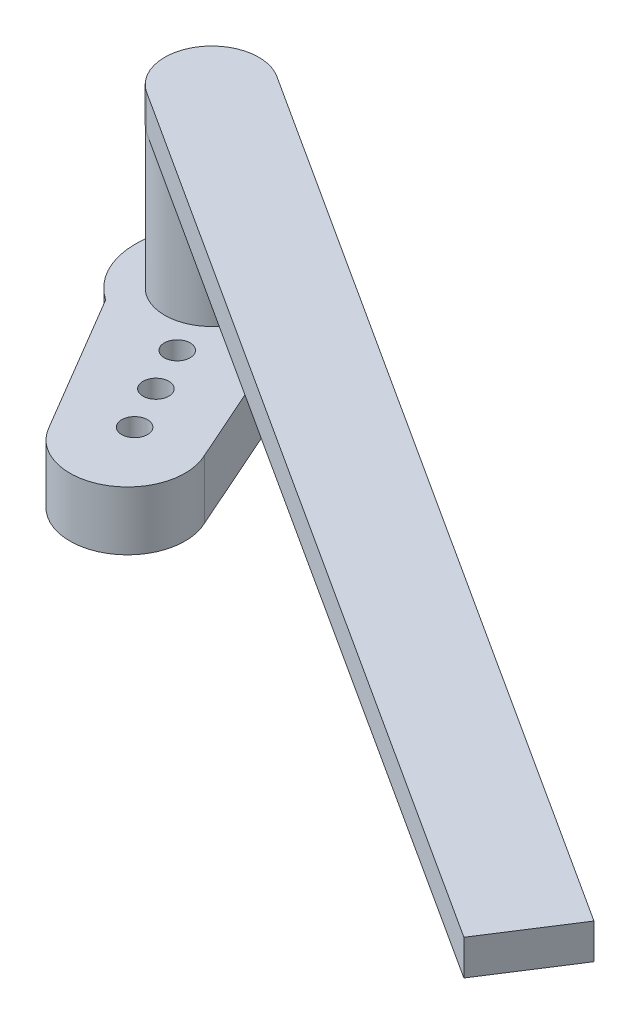
from build123d import *

# Parameters (mm, degrees)
EXTRUDE_4_OUTLINE_R   = 1.1
EXTRUDE_4_OUTLINE_R_2 = 1.75
EXTRUDE_4_DEPTH       = 3
EXTRUDE_START         = 2
EXTRUDE_5_DEPTH       = 2
SKETCH_3_R            = 4
SKETCH_3_R_2          = 1.5
EXTRUDE_6_DEPTH       = 12
EXTRUDE_7_DEPTH       = 3


# Read off the part's stored shape, not the designer's step: 填料-伸長4
with BuildPart() as part:
    # 填料-伸長4 outline → 填料-伸長4 (new body)
    with BuildSketch(Plane(origin=(0, 14.156954032, 0), x_dir=(1, 0, 0), z_dir=(0, 1, 0))):
        with BuildLine():
            Line((-47.225195315, -232.018106976), (-52.72903426, -219.575471046))
            ThreePointArc((-52.72903426, -219.575471046), (-62.201062568, -213.623339578), (-62.862967802, -224.790661134))
            Line((-62.862967802, -224.790661134), (-55.936861757, -236.501360817))
            ThreePointArc((-55.936861757, -236.501360817), (-49.388610218, -238.519947074), (-47.225195315, -232.018106976))
        make_face()
        with Locations((-52.271411996, -232.918210387)):
            Circle(EXTRUDE_4_OUTLINE_R, mode=Mode.SUBTRACT)
        with Locations((-54.193279849, -229.183719263)):
            Circle(EXTRUDE_4_OUTLINE_R, mode=Mode.SUBTRACT)
        with Locations((-59.226743272, -219.402909175)):
            Circle(EXTRUDE_4_OUTLINE_R_2, mode=Mode.SUBTRACT)
        with Locations((-56.115147701, -225.449228139)):
            Circle(EXTRUDE_4_OUTLINE_R, mode=Mode.SUBTRACT)
    extrude(amount=EXTRUDE_4_DEPTH)

    # 草圖2 → 填料-伸長5 (add)
    with BuildSketch(Plane.XZ.offset(-14.156954032).offset(EXTRUDE_START)):
        with BuildLine():
            Line((-52.72903426, 219.575471046), (-47.225195315, 232.018106976))
            ThreePointArc((-47.225195315, 232.018106976), (-49.388610218, 238.519947074), (-55.936861757, 236.501360817))
            Line((-55.936861757, 236.501360817), (-62.862967802, 224.790661134))
            ThreePointArc((-62.862967802, 224.790661134), (-62.201062567, 213.623339578), (-52.72903426, 219.575471046))
        make_face()
        with BuildLine():
            Line((-54.758018868, 219.932533757), (-49.037497118, 232.865028725))
            ThreePointArc((-49.037497118, 232.865028725), (-50.303785386, 236.741617967), (-54.194327422, 235.518869919))
            Line((-54.194327422, 235.518869919), (-61.393110067, 223.347127084))
            ThreePointArc((-61.393110067, 223.347127084), (-61.2858874, 215.401668685), (-54.758018868, 219.932533757))
        make_face(mode=Mode.SUBTRACT)
    extrude(amount=-EXTRUDE_5_DEPTH)

    # 草圖3 → 填料-伸長6 (add)
    with BuildSketch(Plane(origin=(0, 17.156954032, 0), x_dir=(1, 0, 0), z_dir=(0, 1, 0))):
        with Locations(Location((-59.226743272, -219.402909175, 0), (0, 0, 270))):
            Circle(SKETCH_3_R)
        with Locations(Location((-59.226743272, -219.402909175, 0), (0, 0, 270))):
            Circle(SKETCH_3_R_2, mode=Mode.SUBTRACT)
    extrude(amount=EXTRUDE_6_DEPTH)

    # 草圖4 → 填料-伸長7 (add)
    with BuildSketch(Plane(origin=(0, 29.156954032, 0), x_dir=(1, 0, 0), z_dir=(0, 1, 0))):
        with BuildLine():
            Line((-57.061762074, -216.03945018), (18.616065321, -264.75152713))
            Line((18.616065321, -264.75152713), (14.286102925, -271.478445121))
            Line((14.286102925, -271.478445121), (-61.39172447, -222.766368171))
            ThreePointArc((-61.39172447, -222.766368171), (-62.590202267, -217.237927978), (-57.061762074, -216.03945018))
        make_face()
    extrude(amount=EXTRUDE_7_DEPTH)


solid = part.part
